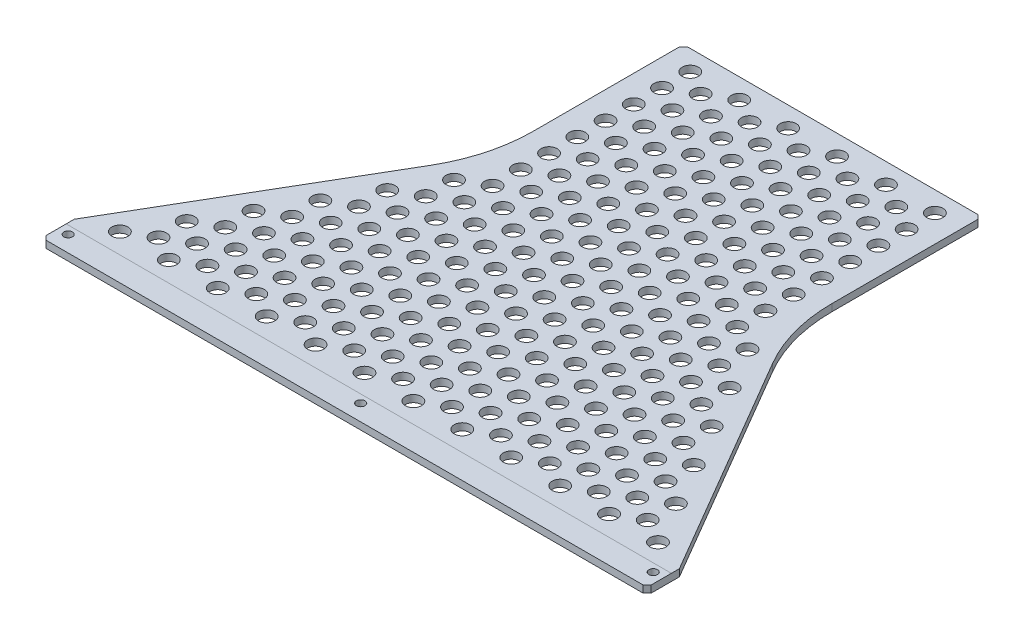
from build123d import *

# Parameters (mm, degrees)
BOSS_EXTRUDE1_DEPTH     = 5.588
FILL_PATTERN1_OUTLINE_R = 6.35
FILL_PATTERN1_DEPTH     = 5.588
SKETCH3_R               = 3.3782
CUT_EXTRUDE1_DEPTH      = 453.023419741
CHAMFER1_SIZE           = 3.175


# Read off the part's stored shape, not the designer's step: Fill Pattern1
with BuildPart() as part:
    # Sketch1 → Boss-Extrude1 (new body)
    with BuildSketch(Plane(origin=(0, 0, 0), x_dir=(1, 0, 0), z_dir=(0, 1, 0))):
        with BuildLine():
            Line((238.125, 0), (-238.125, 0))
            Line((-238.125, 0), (-238.125, 25.4))
            Line((-238.125, 25.4), (-134.836307147, 202.078027249))
            ThreePointArc((-134.836307147, 202.078027249), (-121.892142323, 232.971436694), (-117.475, 266.17449384))
            Line((-117.475, 266.17449384), (-117.475, 384.175))
            Line((-117.475, 384.175), (117.475, 384.175))
            Line((117.475, 384.175), (117.475, 266.17449384))
            ThreePointArc((117.475, 266.17449384), (121.892142323, 232.971436694), (134.836307147, 202.078027249))
            Line((134.836307147, 202.078027249), (238.125, 25.4))
            Line((238.125, 25.4), (238.125, 0))
        make_face()
    extrude(amount=BOSS_EXTRUDE1_DEPTH)

    # Fill Pattern1 outline → Fill Pattern1 (cut)
    with BuildSketch(Plane(origin=(0, 0, 0), x_dir=(1, 0, 0), z_dir=(0, 1, 0))):
        with Locations((-134.731902194, 79.375)):
            Circle(FILL_PATTERN1_OUTLINE_R)
        with Locations((-173.226731392, 79.375)):
            Circle(FILL_PATTERN1_OUTLINE_R)
        with Locations((38.494829198, 357.1875)):
            Circle(FILL_PATTERN1_OUTLINE_R)
        with Locations((38.494829198, 334.9625)):
            Circle(FILL_PATTERN1_OUTLINE_R)
        with Locations((38.494829198, 312.7375)):
            Circle(FILL_PATTERN1_OUTLINE_R)
        with Locations((38.494829198, 290.5125)):
            Circle(FILL_PATTERN1_OUTLINE_R)
        with Locations((38.494829198, 268.2875)):
            Circle(FILL_PATTERN1_OUTLINE_R)
        with Locations((57.742243797, 234.95)):
            Circle(FILL_PATTERN1_OUTLINE_R)
        with Locations((-96.237072996, 79.375)):
            Circle(FILL_PATTERN1_OUTLINE_R)
        with Locations((-57.742243797, 79.375)):
            Circle(FILL_PATTERN1_OUTLINE_R)
        with Locations((-19.247414599, 79.375)):
            Circle(FILL_PATTERN1_OUTLINE_R)
        with Locations((19.247414599, 79.375)):
            Circle(FILL_PATTERN1_OUTLINE_R)
        with Locations((57.742243797, 79.375)):
            Circle(FILL_PATTERN1_OUTLINE_R)
        with Locations((96.237072996, 79.375)):
            Circle(FILL_PATTERN1_OUTLINE_R)
        with Locations((134.731902194, 79.375)):
            Circle(FILL_PATTERN1_OUTLINE_R)
        with Locations((115.484487595, 112.7125)):
            Circle(FILL_PATTERN1_OUTLINE_R)
        with Locations((0, 68.2625)):
            Circle(FILL_PATTERN1_OUTLINE_R)
        with Locations((-38.494829198, 68.2625)):
            Circle(FILL_PATTERN1_OUTLINE_R)
        with Locations((-76.989658396, 68.2625)):
            Circle(FILL_PATTERN1_OUTLINE_R)
        with Locations((-115.484487595, 68.2625)):
            Circle(FILL_PATTERN1_OUTLINE_R)
        with Locations((-153.979316793, 68.2625)):
            Circle(FILL_PATTERN1_OUTLINE_R)
        with Locations((-192.474145991, 68.2625)):
            Circle(FILL_PATTERN1_OUTLINE_R)
        with Locations((57.742243797, 368.3)):
            Circle(FILL_PATTERN1_OUTLINE_R)
        with Locations((57.742243797, 346.075)):
            Circle(FILL_PATTERN1_OUTLINE_R)
        with Locations((38.494829198, 68.2625)):
            Circle(FILL_PATTERN1_OUTLINE_R)
        with Locations((76.989658396, 68.2625)):
            Circle(FILL_PATTERN1_OUTLINE_R)
        with Locations((115.484487595, 68.2625)):
            Circle(FILL_PATTERN1_OUTLINE_R)
        with Locations((153.979316793, 68.2625)):
            Circle(FILL_PATTERN1_OUTLINE_R)
        with Locations((134.731902194, 101.6)):
            Circle(FILL_PATTERN1_OUTLINE_R)
        with Locations((115.484487595, 134.9375)):
            Circle(FILL_PATTERN1_OUTLINE_R)
        with Locations((96.237072996, 168.275)):
            Circle(FILL_PATTERN1_OUTLINE_R)
        with Locations((76.989658396, 201.6125)):
            Circle(FILL_PATTERN1_OUTLINE_R)
        with Locations((115.484487595, 90.4875)):
            Circle(FILL_PATTERN1_OUTLINE_R)
        with Locations((96.237072996, 123.825)):
            Circle(FILL_PATTERN1_OUTLINE_R)
        with Locations((76.989658396, 157.1625)):
            Circle(FILL_PATTERN1_OUTLINE_R)
        with Locations((57.742243797, 190.5)):
            Circle(FILL_PATTERN1_OUTLINE_R)
        with Locations((38.494829198, 223.8375)):
            Circle(FILL_PATTERN1_OUTLINE_R)
        with Locations((19.247414599, 257.175)):
            Circle(FILL_PATTERN1_OUTLINE_R)
        with Locations((0, 290.5125)):
            Circle(FILL_PATTERN1_OUTLINE_R)
        with Locations((0, 312.7375)):
            Circle(FILL_PATTERN1_OUTLINE_R)
        with Locations((19.247414599, 101.6)):
            Circle(FILL_PATTERN1_OUTLINE_R)
        with Locations((-19.247414599, 101.6)):
            Circle(FILL_PATTERN1_OUTLINE_R)
        with Locations((-57.742243797, 101.6)):
            Circle(FILL_PATTERN1_OUTLINE_R)
        with Locations((-96.237072996, 101.6)):
            Circle(FILL_PATTERN1_OUTLINE_R)
        with Locations((-134.731902194, 101.6)):
            Circle(FILL_PATTERN1_OUTLINE_R)
        with Locations((-173.226731392, 101.6)):
            Circle(FILL_PATTERN1_OUTLINE_R)
        with Locations((0, 357.1875)):
            Circle(FILL_PATTERN1_OUTLINE_R)
        with Locations((0, 334.9625)):
            Circle(FILL_PATTERN1_OUTLINE_R)
        with Locations((96.237072996, 146.05)):
            Circle(FILL_PATTERN1_OUTLINE_R)
        with Locations((76.989658396, 179.3875)):
            Circle(FILL_PATTERN1_OUTLINE_R)
        with Locations((57.742243797, 212.725)):
            Circle(FILL_PATTERN1_OUTLINE_R)
        with Locations((38.494829198, 246.0625)):
            Circle(FILL_PATTERN1_OUTLINE_R)
        with Locations((19.247414599, 279.4)):
            Circle(FILL_PATTERN1_OUTLINE_R)
        with Locations((19.247414599, 301.625)):
            Circle(FILL_PATTERN1_OUTLINE_R)
        with Locations((19.247414599, 323.85)):
            Circle(FILL_PATTERN1_OUTLINE_R)
        with Locations((19.247414599, 346.075)):
            Circle(FILL_PATTERN1_OUTLINE_R)
        with Locations((76.989658396, 90.4875)):
            Circle(FILL_PATTERN1_OUTLINE_R)
        with Locations((38.494829198, 90.4875)):
            Circle(FILL_PATTERN1_OUTLINE_R)
        with Locations((0, 90.4875)):
            Circle(FILL_PATTERN1_OUTLINE_R)
        with Locations((-38.494829198, 90.4875)):
            Circle(FILL_PATTERN1_OUTLINE_R)
        with Locations((19.247414599, 368.3)):
            Circle(FILL_PATTERN1_OUTLINE_R)
        with Locations((-153.979316793, 90.4875)):
            Circle(FILL_PATTERN1_OUTLINE_R)
        with Locations((-115.484487595, 90.4875)):
            Circle(FILL_PATTERN1_OUTLINE_R)
        with Locations((-76.989658396, 90.4875)):
            Circle(FILL_PATTERN1_OUTLINE_R)
        with Locations((96.237072996, 323.85)):
            Circle(FILL_PATTERN1_OUTLINE_R)
        with Locations((96.237072996, 346.075)):
            Circle(FILL_PATTERN1_OUTLINE_R)
        with Locations((96.237072996, 368.3)):
            Circle(FILL_PATTERN1_OUTLINE_R)
        with Locations((-192.474145991, 46.0375)):
            Circle(FILL_PATTERN1_OUTLINE_R)
        with Locations((96.237072996, 301.625)):
            Circle(FILL_PATTERN1_OUTLINE_R)
        with Locations((96.237072996, 279.4)):
            Circle(FILL_PATTERN1_OUTLINE_R)
        with Locations((96.237072996, 257.175)):
            Circle(FILL_PATTERN1_OUTLINE_R)
        with Locations((96.237072996, 234.95)):
            Circle(FILL_PATTERN1_OUTLINE_R)
        with Locations((-153.979316793, 46.0375)):
            Circle(FILL_PATTERN1_OUTLINE_R)
        with Locations((-115.484487595, 46.0375)):
            Circle(FILL_PATTERN1_OUTLINE_R)
        with Locations((-76.989658396, 46.0375)):
            Circle(FILL_PATTERN1_OUTLINE_R)
        with Locations((-38.494829198, 46.0375)):
            Circle(FILL_PATTERN1_OUTLINE_R)
        with Locations((0, 46.0375)):
            Circle(FILL_PATTERN1_OUTLINE_R)
        with Locations((38.494829198, 46.0375)):
            Circle(FILL_PATTERN1_OUTLINE_R)
        with Locations((76.989658396, 46.0375)):
            Circle(FILL_PATTERN1_OUTLINE_R)
        with Locations((115.484487595, 46.0375)):
            Circle(FILL_PATTERN1_OUTLINE_R)
        with Locations((115.484487595, 201.6125)):
            Circle(FILL_PATTERN1_OUTLINE_R)
        with Locations((134.731902194, 168.275)):
            Circle(FILL_PATTERN1_OUTLINE_R)
        with Locations((153.979316793, 134.9375)):
            Circle(FILL_PATTERN1_OUTLINE_R)
        with Locations((173.226731392, 101.6)):
            Circle(FILL_PATTERN1_OUTLINE_R)
        with Locations((192.474145991, 68.2625)):
            Circle(FILL_PATTERN1_OUTLINE_R)
        with Locations((211.72156059, 34.925)):
            Circle(FILL_PATTERN1_OUTLINE_R)
        with Locations((173.226731392, 34.925)):
            Circle(FILL_PATTERN1_OUTLINE_R)
        with Locations((134.731902194, 34.925)):
            Circle(FILL_PATTERN1_OUTLINE_R)
        with Locations((96.237072996, 34.925)):
            Circle(FILL_PATTERN1_OUTLINE_R)
        with Locations((57.742243797, 34.925)):
            Circle(FILL_PATTERN1_OUTLINE_R)
        with Locations((19.247414599, 34.925)):
            Circle(FILL_PATTERN1_OUTLINE_R)
        with Locations((-19.247414599, 34.925)):
            Circle(FILL_PATTERN1_OUTLINE_R)
        with Locations((-57.742243797, 34.925)):
            Circle(FILL_PATTERN1_OUTLINE_R)
        with Locations((-96.237072996, 34.925)):
            Circle(FILL_PATTERN1_OUTLINE_R)
        with Locations((-134.731902194, 34.925)):
            Circle(FILL_PATTERN1_OUTLINE_R)
        with Locations((-173.226731392, 34.925)):
            Circle(FILL_PATTERN1_OUTLINE_R)
        with Locations((57.742243797, 323.85)):
            Circle(FILL_PATTERN1_OUTLINE_R)
        with Locations((57.742243797, 301.625)):
            Circle(FILL_PATTERN1_OUTLINE_R)
        with Locations((57.742243797, 279.4)):
            Circle(FILL_PATTERN1_OUTLINE_R)
        with Locations((57.742243797, 257.175)):
            Circle(FILL_PATTERN1_OUTLINE_R)
        with Locations((76.989658396, 223.8375)):
            Circle(FILL_PATTERN1_OUTLINE_R)
        with Locations((96.237072996, 190.5)):
            Circle(FILL_PATTERN1_OUTLINE_R)
        with Locations((115.484487595, 157.1625)):
            Circle(FILL_PATTERN1_OUTLINE_R)
        with Locations((134.731902194, 123.825)):
            Circle(FILL_PATTERN1_OUTLINE_R)
        with Locations((153.979316793, 90.4875)):
            Circle(FILL_PATTERN1_OUTLINE_R)
        with Locations((173.226731392, 57.15)):
            Circle(FILL_PATTERN1_OUTLINE_R)
        with Locations((134.731902194, 57.15)):
            Circle(FILL_PATTERN1_OUTLINE_R)
        with Locations((96.237072996, 57.15)):
            Circle(FILL_PATTERN1_OUTLINE_R)
        with Locations((57.742243797, 57.15)):
            Circle(FILL_PATTERN1_OUTLINE_R)
        with Locations((19.247414599, 57.15)):
            Circle(FILL_PATTERN1_OUTLINE_R)
        with Locations((-19.247414599, 57.15)):
            Circle(FILL_PATTERN1_OUTLINE_R)
        with Locations((-57.742243797, 57.15)):
            Circle(FILL_PATTERN1_OUTLINE_R)
        with Locations((153.979316793, 46.0375)):
            Circle(FILL_PATTERN1_OUTLINE_R)
        with Locations((192.474145991, 46.0375)):
            Circle(FILL_PATTERN1_OUTLINE_R)
        with Locations((173.226731392, 79.375)):
            Circle(FILL_PATTERN1_OUTLINE_R)
        with Locations((153.979316793, 112.7125)):
            Circle(FILL_PATTERN1_OUTLINE_R)
        with Locations((134.731902194, 146.05)):
            Circle(FILL_PATTERN1_OUTLINE_R)
        with Locations((115.484487595, 179.3875)):
            Circle(FILL_PATTERN1_OUTLINE_R)
        with Locations((96.237072996, 212.725)):
            Circle(FILL_PATTERN1_OUTLINE_R)
        with Locations((76.989658396, 246.0625)):
            Circle(FILL_PATTERN1_OUTLINE_R)
        with Locations((76.989658396, 357.1875)):
            Circle(FILL_PATTERN1_OUTLINE_R)
        with Locations((-173.226731392, 57.15)):
            Circle(FILL_PATTERN1_OUTLINE_R)
        with Locations((-134.731902194, 57.15)):
            Circle(FILL_PATTERN1_OUTLINE_R)
        with Locations((-96.237072996, 57.15)):
            Circle(FILL_PATTERN1_OUTLINE_R)
        with Locations((76.989658396, 334.9625)):
            Circle(FILL_PATTERN1_OUTLINE_R)
        with Locations((76.989658396, 312.7375)):
            Circle(FILL_PATTERN1_OUTLINE_R)
        with Locations((76.989658396, 290.5125)):
            Circle(FILL_PATTERN1_OUTLINE_R)
        with Locations((76.989658396, 268.2875)):
            Circle(FILL_PATTERN1_OUTLINE_R)
        with Locations((-57.742243797, 234.95)):
            Circle(FILL_PATTERN1_OUTLINE_R)
        with Locations((-38.494829198, 201.6125)):
            Circle(FILL_PATTERN1_OUTLINE_R)
        with Locations((-19.247414599, 168.275)):
            Circle(FILL_PATTERN1_OUTLINE_R)
        with Locations((-57.742243797, 168.275)):
            Circle(FILL_PATTERN1_OUTLINE_R)
        with Locations((-96.237072996, 168.275)):
            Circle(FILL_PATTERN1_OUTLINE_R)
        with Locations((-134.731902194, 168.275)):
            Circle(FILL_PATTERN1_OUTLINE_R)
        with Locations((-96.237072996, 323.85)):
            Circle(FILL_PATTERN1_OUTLINE_R)
        with Locations((-76.989658396, 290.5125)):
            Circle(FILL_PATTERN1_OUTLINE_R)
        with Locations((-96.237072996, 368.3)):
            Circle(FILL_PATTERN1_OUTLINE_R)
        with Locations((-115.484487595, 157.1625)):
            Circle(FILL_PATTERN1_OUTLINE_R)
        with Locations((-76.989658396, 157.1625)):
            Circle(FILL_PATTERN1_OUTLINE_R)
        with Locations((-38.494829198, 157.1625)):
            Circle(FILL_PATTERN1_OUTLINE_R)
        with Locations((0, 157.1625)):
            Circle(FILL_PATTERN1_OUTLINE_R)
        with Locations((-19.247414599, 190.5)):
            Circle(FILL_PATTERN1_OUTLINE_R)
        with Locations((-38.494829198, 223.8375)):
            Circle(FILL_PATTERN1_OUTLINE_R)
        with Locations((-57.742243797, 257.175)):
            Circle(FILL_PATTERN1_OUTLINE_R)
        with Locations((-96.237072996, 190.5)):
            Circle(FILL_PATTERN1_OUTLINE_R)
        with Locations((-57.742243797, 190.5)):
            Circle(FILL_PATTERN1_OUTLINE_R)
        with Locations((-76.989658396, 223.8375)):
            Circle(FILL_PATTERN1_OUTLINE_R)
        with Locations((-96.237072996, 257.175)):
            Circle(FILL_PATTERN1_OUTLINE_R)
        with Locations((-96.237072996, 212.725)):
            Circle(FILL_PATTERN1_OUTLINE_R)
        with Locations((-96.237072996, 234.95)):
            Circle(FILL_PATTERN1_OUTLINE_R)
        with Locations((-76.989658396, 201.6125)):
            Circle(FILL_PATTERN1_OUTLINE_R)
        with Locations((-115.484487595, 201.6125)):
            Circle(FILL_PATTERN1_OUTLINE_R)
        with Locations((-76.989658396, 268.2875)):
            Circle(FILL_PATTERN1_OUTLINE_R)
        with Locations((-96.237072996, 301.625)):
            Circle(FILL_PATTERN1_OUTLINE_R)
        with Locations((-115.484487595, 179.3875)):
            Circle(FILL_PATTERN1_OUTLINE_R)
        with Locations((-76.989658396, 179.3875)):
            Circle(FILL_PATTERN1_OUTLINE_R)
        with Locations((-38.494829198, 179.3875)):
            Circle(FILL_PATTERN1_OUTLINE_R)
        with Locations((-57.742243797, 212.725)):
            Circle(FILL_PATTERN1_OUTLINE_R)
        with Locations((-76.989658396, 246.0625)):
            Circle(FILL_PATTERN1_OUTLINE_R)
        with Locations((-96.237072996, 279.4)):
            Circle(FILL_PATTERN1_OUTLINE_R)
        with Locations((38.494829198, 112.7125)):
            Circle(FILL_PATTERN1_OUTLINE_R)
        with Locations((76.989658396, 112.7125)):
            Circle(FILL_PATTERN1_OUTLINE_R)
        with Locations((57.742243797, 146.05)):
            Circle(FILL_PATTERN1_OUTLINE_R)
        with Locations((38.494829198, 179.3875)):
            Circle(FILL_PATTERN1_OUTLINE_R)
        with Locations((19.247414599, 212.725)):
            Circle(FILL_PATTERN1_OUTLINE_R)
        with Locations((0, 246.0625)):
            Circle(FILL_PATTERN1_OUTLINE_R)
        with Locations((-19.247414599, 279.4)):
            Circle(FILL_PATTERN1_OUTLINE_R)
        with Locations((-38.494829198, 312.7375)):
            Circle(FILL_PATTERN1_OUTLINE_R)
        with Locations((57.742243797, 123.825)):
            Circle(FILL_PATTERN1_OUTLINE_R)
        with Locations((19.247414599, 123.825)):
            Circle(FILL_PATTERN1_OUTLINE_R)
        with Locations((-19.247414599, 123.825)):
            Circle(FILL_PATTERN1_OUTLINE_R)
        with Locations((-57.742243797, 123.825)):
            Circle(FILL_PATTERN1_OUTLINE_R)
        with Locations((-96.237072996, 123.825)):
            Circle(FILL_PATTERN1_OUTLINE_R)
        with Locations((-134.731902194, 123.825)):
            Circle(FILL_PATTERN1_OUTLINE_R)
        with Locations((-38.494829198, 357.1875)):
            Circle(FILL_PATTERN1_OUTLINE_R)
        with Locations((-38.494829198, 334.9625)):
            Circle(FILL_PATTERN1_OUTLINE_R)
        with Locations((57.742243797, 101.6)):
            Circle(FILL_PATTERN1_OUTLINE_R)
        with Locations((96.237072996, 101.6)):
            Circle(FILL_PATTERN1_OUTLINE_R)
        with Locations((76.989658396, 134.9375)):
            Circle(FILL_PATTERN1_OUTLINE_R)
        with Locations((57.742243797, 168.275)):
            Circle(FILL_PATTERN1_OUTLINE_R)
        with Locations((38.494829198, 201.6125)):
            Circle(FILL_PATTERN1_OUTLINE_R)
        with Locations((19.247414599, 234.95)):
            Circle(FILL_PATTERN1_OUTLINE_R)
        with Locations((0, 268.2875)):
            Circle(FILL_PATTERN1_OUTLINE_R)
        with Locations((-19.247414599, 301.625)):
            Circle(FILL_PATTERN1_OUTLINE_R)
        with Locations((0, 112.7125)):
            Circle(FILL_PATTERN1_OUTLINE_R)
        with Locations((-38.494829198, 112.7125)):
            Circle(FILL_PATTERN1_OUTLINE_R)
        with Locations((-76.989658396, 112.7125)):
            Circle(FILL_PATTERN1_OUTLINE_R)
        with Locations((-115.484487595, 112.7125)):
            Circle(FILL_PATTERN1_OUTLINE_R)
        with Locations((-19.247414599, 323.85)):
            Circle(FILL_PATTERN1_OUTLINE_R)
        with Locations((-19.247414599, 346.075)):
            Circle(FILL_PATTERN1_OUTLINE_R)
        with Locations((-19.247414599, 368.3)):
            Circle(FILL_PATTERN1_OUTLINE_R)
        with Locations((-153.979316793, 112.7125)):
            Circle(FILL_PATTERN1_OUTLINE_R)
        with Locations((-76.989658396, 357.1875)):
            Circle(FILL_PATTERN1_OUTLINE_R)
        with Locations((-134.731902194, 146.05)):
            Circle(FILL_PATTERN1_OUTLINE_R)
        with Locations((-96.237072996, 146.05)):
            Circle(FILL_PATTERN1_OUTLINE_R)
        with Locations((-57.742243797, 146.05)):
            Circle(FILL_PATTERN1_OUTLINE_R)
        with Locations((-76.989658396, 334.9625)):
            Circle(FILL_PATTERN1_OUTLINE_R)
        with Locations((-57.742243797, 301.625)):
            Circle(FILL_PATTERN1_OUTLINE_R)
        with Locations((-38.494829198, 268.2875)):
            Circle(FILL_PATTERN1_OUTLINE_R)
        with Locations((-19.247414599, 234.95)):
            Circle(FILL_PATTERN1_OUTLINE_R)
        with Locations((-19.247414599, 146.05)):
            Circle(FILL_PATTERN1_OUTLINE_R)
        with Locations((19.247414599, 146.05)):
            Circle(FILL_PATTERN1_OUTLINE_R)
        with Locations((0, 179.3875)):
            Circle(FILL_PATTERN1_OUTLINE_R)
        with Locations((-19.247414599, 212.725)):
            Circle(FILL_PATTERN1_OUTLINE_R)
        with Locations((-38.494829198, 246.0625)):
            Circle(FILL_PATTERN1_OUTLINE_R)
        with Locations((-57.742243797, 279.4)):
            Circle(FILL_PATTERN1_OUTLINE_R)
        with Locations((-76.989658396, 312.7375)):
            Circle(FILL_PATTERN1_OUTLINE_R)
        with Locations((-96.237072996, 346.075)):
            Circle(FILL_PATTERN1_OUTLINE_R)
        with Locations((38.494829198, 157.1625)):
            Circle(FILL_PATTERN1_OUTLINE_R)
        with Locations((19.247414599, 190.5)):
            Circle(FILL_PATTERN1_OUTLINE_R)
        with Locations((0, 223.8375)):
            Circle(FILL_PATTERN1_OUTLINE_R)
        with Locations((-19.247414599, 257.175)):
            Circle(FILL_PATTERN1_OUTLINE_R)
        with Locations((-38.494829198, 290.5125)):
            Circle(FILL_PATTERN1_OUTLINE_R)
        with Locations((-57.742243797, 323.85)):
            Circle(FILL_PATTERN1_OUTLINE_R)
        with Locations((-57.742243797, 346.075)):
            Circle(FILL_PATTERN1_OUTLINE_R)
        with Locations((-57.742243797, 368.3)):
            Circle(FILL_PATTERN1_OUTLINE_R)
        with Locations((-153.979316793, 134.9375)):
            Circle(FILL_PATTERN1_OUTLINE_R)
        with Locations((-115.484487595, 134.9375)):
            Circle(FILL_PATTERN1_OUTLINE_R)
        with Locations((-76.989658396, 134.9375)):
            Circle(FILL_PATTERN1_OUTLINE_R)
        with Locations((-38.494829198, 134.9375)):
            Circle(FILL_PATTERN1_OUTLINE_R)
        with Locations((0, 134.9375)):
            Circle(FILL_PATTERN1_OUTLINE_R)
        with Locations((38.494829198, 134.9375)):
            Circle(FILL_PATTERN1_OUTLINE_R)
        with Locations((19.247414599, 168.275)):
            Circle(FILL_PATTERN1_OUTLINE_R)
        with Locations((0, 201.6125)):
            Circle(FILL_PATTERN1_OUTLINE_R)
        with Locations((-211.72156059, 34.925)):
            Circle(FILL_PATTERN1_OUTLINE_R)
    extrude(amount=FILL_PATTERN1_DEPTH, mode=Mode.SUBTRACT)

    # Sketch3 → Cut-Extrude1 (cut, through all)
    with BuildSketch(Plane(origin=(0, 5.588, 0), x_dir=(1, 0, 0), z_dir=(0, 1, 0))):
        with Locations(Location((-230.1875, 12.7, 0), (0, 0, 270))):
            Circle(SKETCH3_R)
        with Locations(Location((0, 12.7, 0), (0, 0, 270))):
            Circle(SKETCH3_R)
        with Locations(Location((230.1875, 12.7, 0), (0, 0, 270))):
            Circle(SKETCH3_R)
    extrude(amount=-CUT_EXTRUDE1_DEPTH, mode=Mode.SUBTRACT)

    # Chamfer1
    chamfer1_edges = [part.edges().sort_by_distance(p)[0] for p in [
        (238.125, 2.794, 0),
        (-238.125, 2.794, 0),
        (-117.475, 2.794, -384.175),
        (117.475, 2.794, -384.175),
    ]]
    chamfer(chamfer1_edges, length=CHAMFER1_SIZE)


solid = part.part
